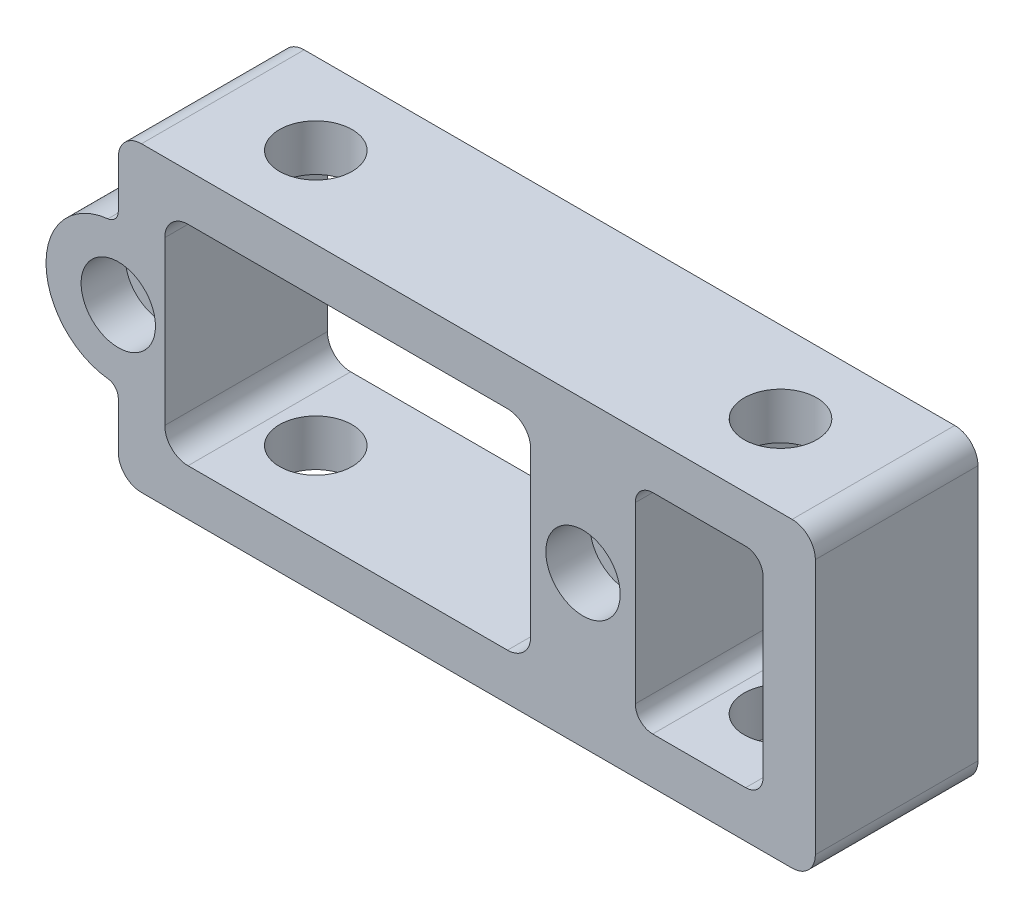
from build123d import *

# Parameters (mm, degrees)
SKETCH1_W           = 101.6
SKETCH1_H           = 17.78
SKETCH1_R           = 3.96875
BOSS_EXTRUDE1_DEPTH = 33.02
SKETCH2_R           = 2.4892
CUT_EXTRUDE1_DEPTH  = 17.78
SKETCH3_R           = 4.064
CUT_EXTRUDE2_DEPTH  = 4.826
CUT_EXTRUDE3_START  = -17.78
CUT_EXTRUDE3_DEPTH  = 17.78
FILLET1_R           = 2.54
SKETCH6_W           = 13.97
SKETCH6_H           = 22.86
SKETCH6_W_2         = 10.94852006
SKETCH6_H_2         = 17.669906062
CUT_EXTRUDE4_DEPTH  = 104.812903953
FILLET2_R           = 1.905


# Read off the part's stored shape, not the designer's step: Cut-Extrude3
with BuildPart() as part:
    # Sketch1 → Boss-Extrude1 (new body)
    with BuildSketch(Plane(origin=(0, 0, 0), x_dir=(1, 0, 0), z_dir=(0, 1, 0))):
        with Locations((50.8, 8.89)):
            Rectangle(SKETCH1_W, SKETCH1_H)
        with Locations(Location((76.2, 8.89, 0), (0, 0, 270))):
            Circle(SKETCH1_R, mode=Mode.SUBTRACT)
        with Locations(Location((25.4, 8.89, 0), (0, 0, 270))):
            Circle(SKETCH1_R, mode=Mode.SUBTRACT)
    extrude(amount=-BOSS_EXTRUDE1_DEPTH)

    # Sketch2 → Cut-Extrude1 (cut)
    with BuildSketch(Plane.XY):
        with Locations((63.5, -16.51)):
            Circle(SKETCH2_R)
        with Locations((12.7, -16.51)):
            Circle(SKETCH2_R)
    extrude(amount=-CUT_EXTRUDE1_DEPTH, mode=Mode.SUBTRACT)

    # Sketch3 → Cut-Extrude2 (cut)
    with BuildSketch(Plane.XY):
        with Locations((63.5, -16.51)):
            Circle(SKETCH3_R)
        with Locations((12.7, -16.51)):
            Circle(SKETCH3_R)
    extrude(amount=-CUT_EXTRUDE2_DEPTH, mode=Mode.SUBTRACT)

    # Cut-Extrude3 outline → Cut-Extrude3 (cut)
    with BuildSketch(Plane.XY.offset(CUT_EXTRUDE3_START)):
        with BuildLine():
            Line((88.9, 0), (88.9, -7.675046969))
            ThreePointArc((88.9, -7.675046969), (89.22339789, -8.521713636), (90.028888889, -8.937183116))
            ThreePointArc((90.028888889, -8.937183116), (96.802222222, -16.51), (90.028888889, -24.082816884))
            ThreePointArc((90.028888889, -24.082816884), (89.22339789, -24.498286364), (88.9, -25.344953031))
            Line((88.9, -25.344953031), (88.9, -33.02))
            Line((88.9, -33.02), (101.6, -33.02))
            Line((101.6, -33.02), (101.6, 0))
            Line((101.6, 0), (88.9, 0))
        make_face()
        with BuildLine():
            Line((12.7, -7.675046969), (12.7, 0))
            Line((12.7, 0), (0, 0))
            Line((0, 0), (0, -33.02))
            Line((0, -33.02), (12.7, -33.02))
            Line((12.7, -33.02), (12.7, -25.344953031))
            ThreePointArc((12.7, -25.344953031), (12.37660211, -24.498286364), (11.571111111, -24.082816884))
            ThreePointArc((11.571111111, -24.082816884), (4.797777778, -16.51), (11.571111111, -8.937183116))
            ThreePointArc((11.571111111, -8.937183116), (12.37660211, -8.521713636), (12.7, -7.675046969))
        make_face()
    extrude(amount=CUT_EXTRUDE3_DEPTH, mode=Mode.SUBTRACT)

    # Fillet1
    fillet1_edges = [part.edges().sort_by_distance(p)[0] for p in [
        (12.7, -33.02, -8.89),
        (12.7, 0, -8.89),
        (88.9, 0, -8.89),
        (88.9, -33.02, -8.89),
    ]]
    fillet(fillet1_edges, radius=FILLET1_R)

    # Sketch6 → Cut-Extrude4 (cut, through all)
    with BuildSketch(Plane.XY):
        with BuildLine():
            Line((17.78, -25.4), (17.78, -7.62))
            ThreePointArc((17.78, -7.62), (18.523948776, -5.823948776), (20.32, -5.08))
            Line((20.32, -5.08), (55.245, -5.08))
            ThreePointArc((55.245, -5.08), (57.041051224, -5.823948776), (57.785, -7.62))
            Line((57.785, -7.62), (57.785, -25.4))
            ThreePointArc((57.785, -25.4), (57.041051224, -27.196051224), (55.245, -27.94))
            Line((55.245, -27.94), (20.32, -27.94))
            ThreePointArc((20.32, -27.94), (18.523948776, -27.196051224), (17.78, -25.4))
        make_face()
        with Locations((76.2, -16.51)):
            Rectangle(SKETCH6_W, SKETCH6_H)
        with Locations((94.37426003, -16.51)):
            Rectangle(SKETCH6_W_2, SKETCH6_H_2)
    extrude(amount=-CUT_EXTRUDE4_DEPTH, mode=Mode.SUBTRACT)

    # Fillet2
    fillet2_edges = [part.edges().sort_by_distance(p)[0] for p in [
        (69.215, -5.08, -8.89),
        (83.185, -27.94, -8.89),
        (83.185, -5.08, -8.89),
        (69.215, -27.94, -8.89),
    ]]
    fillet(fillet2_edges, radius=FILLET2_R)


solid = part.part
